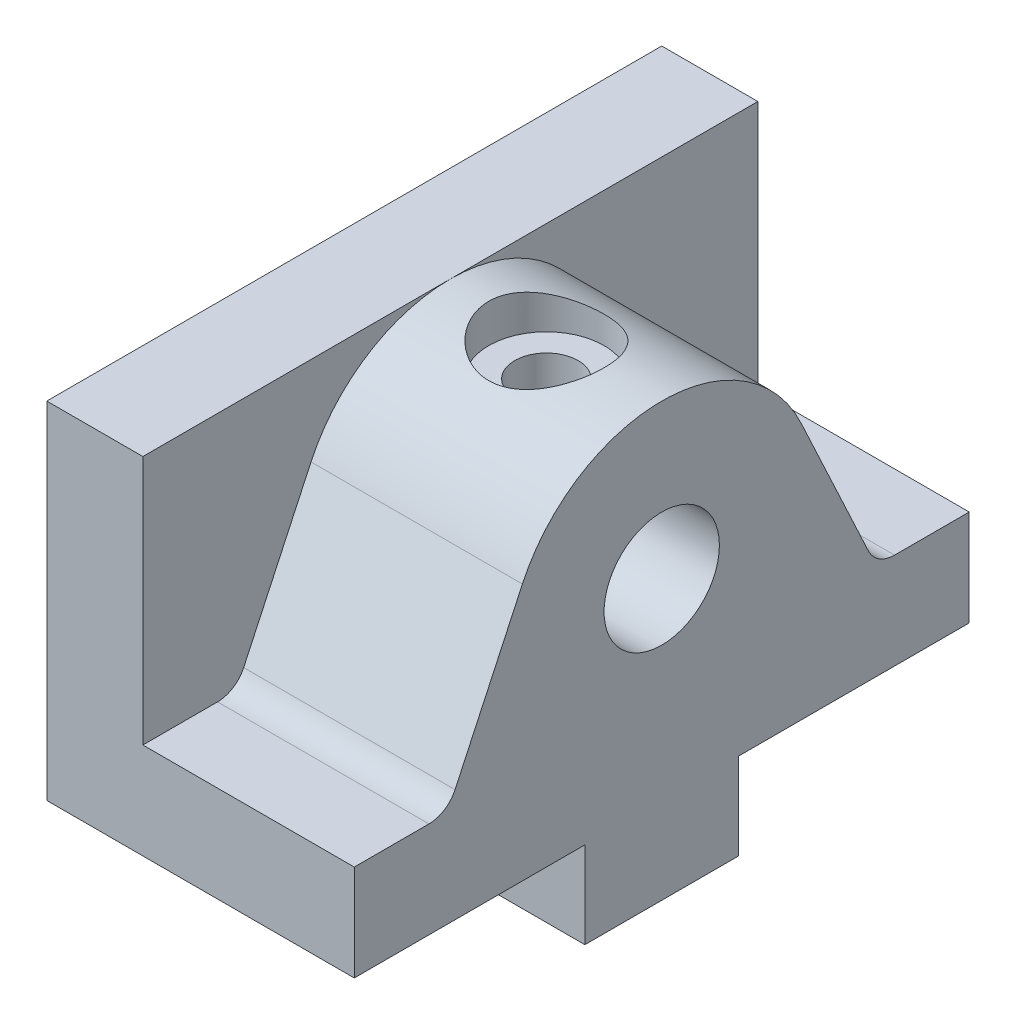
from build123d import *

# Parameters (mm, degrees)
SKETCH1_W                               = 16
SKETCH1_H                               = 9
SKETCH1_R                               = 6
BOSS_EXTRUDE1_DEPTH                     = 32
BOSS_EXTRUDE2_DEPTH                     = 10
CUT_EXTRUDE1_START                      = 32
SKETCH1_4_R                             = 6
CUT_EXTRUDE1_DEPTH                      = 24
FILLET1_R                               = 3
CBORE_START                             = 14
CBORE_FOR_M6_HEX_HEAD_BOLT1_OUTLINE_R   = 6
CBORE_FOR_M6_HEX_HEAD_BOLT1_DEPTH       = 4
CBORE_START_2                           = 7.010987826
CBORE_FOR_M6_HEX_HEAD_BOLT1_2_OUTLINE_R = 3.3
CBORE_FOR_M6_HEX_HEAD_BOLT1_2_DEPTH     = 6.989012174
M6X1_0_TAPPED_HOLE1_D                   = 5
M6X1_0_TAPPED_HOLE1_DEPTH               = 16
M6X1_0_TAPPED_HOLE1_TIP                 = 1.502151548


# Read off the part's stored shape, not the designer's step: CBORE for M6 Hex Head Bolt1
with BuildPart() as part:
    # Sketch1 → Boss-Extrude1 (new body)
    # profile 1 of 4: a face of its own
    with BuildSketch(Plane(origin=(0, 0, 0), x_dir=(0, 0, -1), z_dir=(1, 0, 0))):
        Polygon((-22.317123285, -8), (-32, -8), (-32, -18), (-8, -18), (8, -18), (32, -18), (32, -8), (22.317123285, -8), align=None)
    # profile 2 of 4: a face of its own
    with BuildSketch(Plane(origin=(0, 0, 0), x_dir=(0, 0, -1), z_dir=(1, 0, 0))):
        with Locations((0, -22.5)):
            Rectangle(SKETCH1_W, SKETCH1_H)
    # profile 3 of 4: a face of its own
    with BuildSketch(Plane(origin=(0, 0, 0), x_dir=(0, 0, -1), z_dir=(1, 0, 0))):
        with BuildLine():
            Line((-14.500924593, 8.761892188), (-22.317123285, -8))
            Line((-22.317123285, -8), (22.317123285, -8))
            Line((22.317123285, -8), (14.500924593, 8.761892188))
            ThreePointArc((14.500924593, 8.761892188), (8.596793684, 15.494263165), (-1.18e-07, 18))
            ThreePointArc((-1.18e-07, 18), (-8.596793783, 15.494263101), (-14.500924593, 8.761892188))
        make_face()
        with Locations((0, 2)):
            Circle(SKETCH1_R, mode=Mode.SUBTRACT)
    # profile 4 of 4: a face of its own
    with BuildSketch(Plane(origin=(0, 0, 0), x_dir=(0, 0, -1), z_dir=(1, 0, 0))):
        with Locations((0, 2)):
            Circle(SKETCH1_R)
    extrude(amount=BOSS_EXTRUDE1_DEPTH)

    # Sketch1<3> → Boss-Extrude2 (add)
    with BuildSketch(Plane(origin=(0, 0, 0), x_dir=(0, 0, -1), z_dir=(1, 0, 0))):
        with BuildLine():
            Line((-32, 18), (-32, -8))
            Line((-32, -8), (-22.317123285, -8))
            Line((-22.317123285, -8), (-14.500924593, 8.761892188))
            ThreePointArc((-14.500924593, 8.761892188), (-8.596793783, 15.494263101), (-1.18e-07, 18))
            Line((-1.18e-07, 18), (-32, 18))
        make_face()
        with BuildLine():
            Line((14.500924593, 8.761892188), (22.317123285, -8))
            Line((22.317123285, -8), (32, -8))
            Line((32, -8), (32, 18))
            Line((32, 18), (-1.18e-07, 18))
            ThreePointArc((-1.18e-07, 18), (8.596793684, 15.494263165), (14.500924593, 8.761892188))
        make_face()
    extrude(amount=BOSS_EXTRUDE2_DEPTH)

    # Sketch1<4> → Cut-Extrude1 (cut)
    with BuildSketch(Plane(origin=(0, 0, 0), x_dir=(0, 0, -1), z_dir=(1, 0, 0)).offset(CUT_EXTRUDE1_START)):
        with Locations((0, 2)):
            Circle(SKETCH1_4_R)
    extrude(amount=-CUT_EXTRUDE1_DEPTH, mode=Mode.SUBTRACT)

    # Fillet1
    fillet1_edges = [part.edges().sort_by_distance(p)[0] for p in [
        (21, -8, 22.317123285),
        (21, -8, -22.317123285),
    ]]
    fillet(fillet1_edges, radius=FILLET1_R)

    # CBORE for M6 Hex Head Bolt1 outline → CBORE for M6 Hex Head Bolt1 (cut)
    with BuildSketch(Plane(origin=(0, 0, 0), x_dir=(1, 0, 0), z_dir=(0, 1, 0)).offset(CBORE_START)):
        with Locations((20, 0)):
            Circle(CBORE_FOR_M6_HEX_HEAD_BOLT1_OUTLINE_R)
    extrude(amount=CBORE_FOR_M6_HEX_HEAD_BOLT1_DEPTH, mode=Mode.SUBTRACT)

    # CBORE for M6 Hex Head Bolt1 2 outline → CBORE for M6 Hex Head Bolt1 2 (cut)
    with BuildSketch(Plane(origin=(0, 0, 0), x_dir=(1, 0, 0), z_dir=(0, 1, 0)).offset(CBORE_START_2)):
        with Locations((20, 0)):
            Circle(CBORE_FOR_M6_HEX_HEAD_BOLT1_2_OUTLINE_R)
    extrude(amount=CBORE_FOR_M6_HEX_HEAD_BOLT1_2_DEPTH, mode=Mode.SUBTRACT)

    # M6x1.0 Tapped Hole1
    with Locations(Plane(origin=(0, -27, 0), x_dir=(-1, 0, 0), z_dir=(0, -1, 0))):
        with Locations((-24, 0), (-8, 0)):
            Hole(M6X1_0_TAPPED_HOLE1_D / 2, depth=M6X1_0_TAPPED_HOLE1_DEPTH)
            with Locations((0, 0, -(M6X1_0_TAPPED_HOLE1_DEPTH + M6X1_0_TAPPED_HOLE1_TIP / 2))):  # 118° drill point
                Cone(0, M6X1_0_TAPPED_HOLE1_D / 2, M6X1_0_TAPPED_HOLE1_TIP, mode=Mode.SUBTRACT)


solid = part.part
